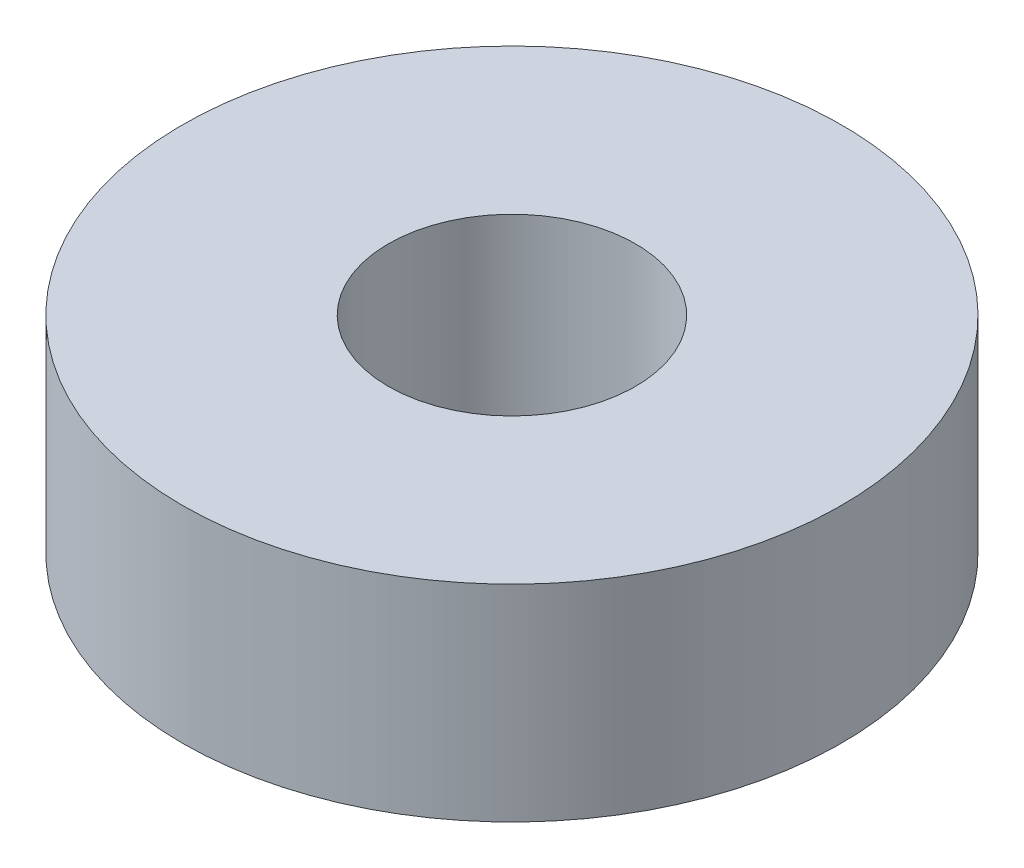
from build123d import *

# Parameters (mm, degrees)
SKETCH1_R           = 40
BOSS_EXTRUDE1_DEPTH = 25
SKETCH2_R           = 15
CUT_EXTRUDE1_DEPTH  = 62.846584384


with BuildPart() as part:
    # Sketch1 → Boss-Extrude1 (new body)
    with BuildSketch(Plane(origin=(0, 0, 0), x_dir=(1, 0, 0), z_dir=(0, 1, 0))):
        Circle(SKETCH1_R)
    extrude(amount=BOSS_EXTRUDE1_DEPTH)

    # Sketch2 → Cut-Extrude1 (cut, through all)
    with BuildSketch(Plane(origin=(0, 0, 0), x_dir=(1, 0, 0), z_dir=(0, 1, 0))):
        Circle(SKETCH2_R)
    extrude(amount=CUT_EXTRUDE1_DEPTH, mode=Mode.SUBTRACT)


solid = part.part
